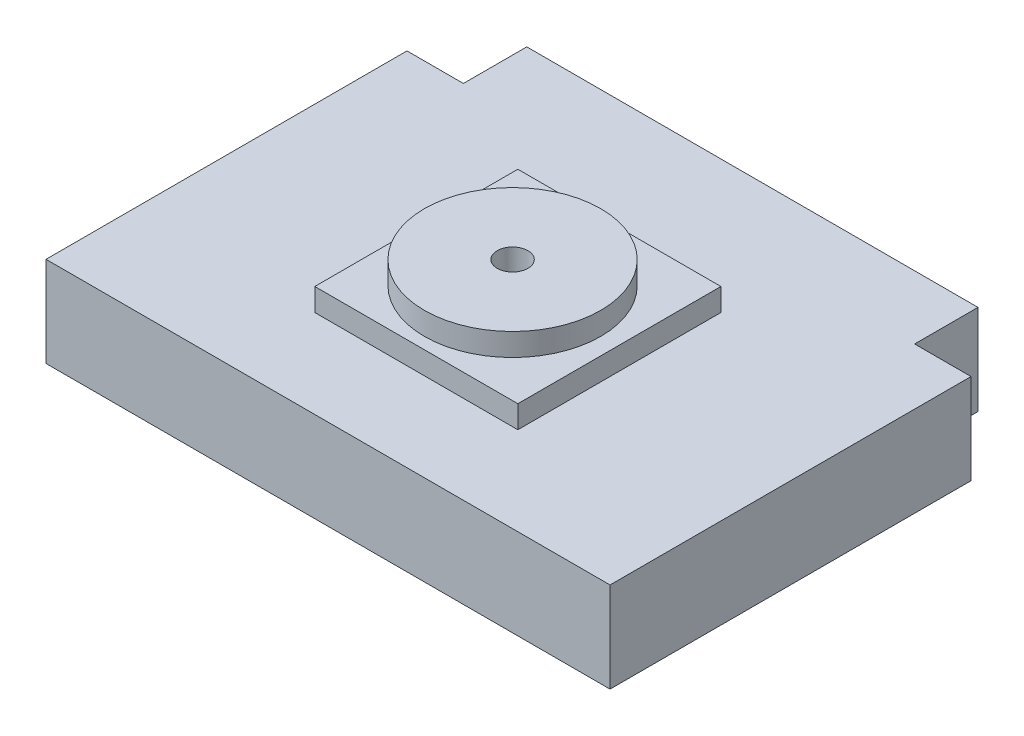
from build123d import *

# Parameters (mm, degrees)
BOSS_EXTRUDE1_DEPTH = 5.08
SKETCH3_W           = 11.43
SKETCH3_H           = 11.43
BOSS_EXTRUDE2_DEPTH = 1.27
SKETCH5_R           = 4.961688794
SKETCH5_R_2         = 0.865135847
BOSS_EXTRUDE3_DEPTH = 1.27


with BuildPart() as part:
    # Sketch1 → Boss-Extrude1 (new body)
    with BuildSketch(Plane(origin=(0, 0, 0), x_dir=(1, 0, 0), z_dir=(0, 1, 0))):
        Polygon((-19.516726296, 9.048937426), (5.883273704, 9.048937426), (5.883273704, 5.480342385), (9.058273704, 5.480342385), (9.058273704, -14.839657615), (-22.691726296, -14.839657615), (-22.691726296, 5.480342385), (-19.516726296, 5.480342385), align=None)
    extrude(amount=BOSS_EXTRUDE1_DEPTH)

    # Sketch3 → Boss-Extrude2 (add)
    with BuildSketch(Plane(origin=(0, 5.08, 0), x_dir=(1, 0, 0), z_dir=(0, 1, 0))):
        with Locations((-6.816726296, -4.154305268)):
            Rectangle(SKETCH3_W, SKETCH3_H)
    extrude(amount=BOSS_EXTRUDE2_DEPTH)

    # Sketch5 → Boss-Extrude3 (add)
    with BuildSketch(Plane(origin=(0, 6.35, 0), x_dir=(1, 0, 0), z_dir=(0, 1, 0))):
        with Locations((-7.009181054, -4.258692446)):
            Circle(SKETCH5_R)
        with Locations((-7.009181054, -4.258692446)):
            Circle(SKETCH5_R_2, mode=Mode.SUBTRACT)
    extrude(amount=BOSS_EXTRUDE3_DEPTH)


solid = part.part
